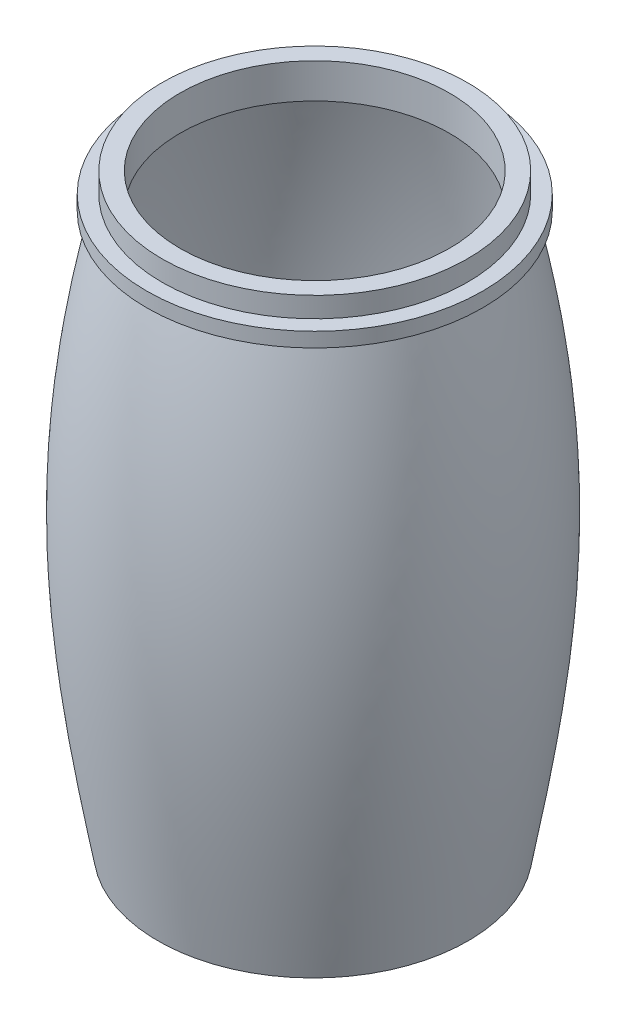
from build123d import *

# Parameters (mm, degrees)
SHELL5_T                    = -5
REVOLVE_THIN1_START         = 984.270895849
REVOLVE_THIN1_OUTLINE_R     = 260.625833246
REVOLVE_THIN1_OUTLINE_R_2   = 248.662190358
REVOLVE_THIN1_OUTLINE_R_3   = 238.662190358
REVOLVE_THIN1_DEPTH         = 61.729775532
REVOLVE_THIN1_2_OUTLINE_R   = 297.647770332
REVOLVE_THIN1_2_OUTLINE_R_2 = 287.647770332
REVOLVE_THIN1_2_OUTLINE_R_3 = 260.625833246
REVOLVE_THIN1_2_OUTLINE_R_4 = 248.662190358
REVOLVE_THIN1_2_DEPTH       = 25.729104151
REVOLVE_THIN1_3_OUTLINE_R   = 287.647770332
REVOLVE_THIN1_3_DEPTH       = 10
REVOLVE_THIN1_START_2       = 1000
REVOLVE_THIN1_4_OUTLINE_R   = 287.647770332
REVOLVE_THIN1_4_DEPTH       = 10
REVOLVE_THIN1_START_3       = 1036.000671381
REVOLVE_THIN1_5_OUTLINE_R   = 260.625833246
REVOLVE_THIN1_5_OUTLINE_R_2 = 248.662190358
REVOLVE_THIN1_5_DEPTH       = 10


# Read off the part's stored shape, not the designer's step: Revolve-Thin1
with BuildPart() as part:
    # Sketch1 → Revolve1 (revolve)
    with BuildSketch(Plane.XY):
        with BuildLine():
            Line((0, 0), (275, 0))
            add(Edge.make_bspline(
                [(275, 0), (334.204802315, 324.77989034), (372.23427441, 596.018832728), (272.550609758, 1000)],
                knots=[0, 0, 0, 0, 1, 1, 1, 1], degree=3))
            Line((272.550609758, 1000), (0, 1000))
            Line((0, 1000), (0, 0))
        make_face()
    revolve(axis=Axis((0, 0, 0), (0, 1, 0)))

    # Shell5
    shell5_openings = [part.faces().sort_by_distance(p)[0] for p in [
        (0, 1000, 0),
    ]]
    offset(amount=SHELL5_T, openings=shell5_openings, kind=Kind.INTERSECTION)

    # Revolve-Thin1 outline → Revolve-Thin1 (add)
    # profile 1 of 2: a face of its own
    with BuildSketch(Plane(origin=(0, 0, 0), x_dir=(1, 0, 0), z_dir=(0, 1, 0)).offset(REVOLVE_THIN1_START)):
        with BuildLine():
            ThreePointArc((-161.763347416, -214.689033182), (273.625833246, 0), (-161.763347416, 214.689033182))
            ThreePointArc((-161.763347416, 214.689033182), (-267.625833246, 0), (-161.763347416, -214.689033182))
        make_face()
        with Locations((3, 0)):
            Circle(REVOLVE_THIN1_OUTLINE_R, mode=Mode.SUBTRACT)
    # profile 2 of 2: a face of its own
    with BuildSketch(Plane(origin=(0, 0, 0), x_dir=(1, 0, 0), z_dir=(0, 1, 0)).offset(REVOLVE_THIN1_START)):
        with Locations((3, 0)):
            Circle(REVOLVE_THIN1_OUTLINE_R_2)
        with Locations((3, 0)):
            Circle(REVOLVE_THIN1_OUTLINE_R_3, mode=Mode.SUBTRACT)
    extrude(amount=REVOLVE_THIN1_DEPTH)

    # Revolve-Thin1 2 outline → Revolve-Thin1 2 (add)
    # profile 1 of 2: a face of its own
    with BuildSketch(Plane(origin=(0, 0, 0), x_dir=(1, 0, 0), z_dir=(0, 1, 0)).offset(REVOLVE_THIN1_START)):
        with Locations((3, 0)):
            Circle(REVOLVE_THIN1_2_OUTLINE_R)
        with Locations((3, 0)):
            Circle(REVOLVE_THIN1_2_OUTLINE_R_2, mode=Mode.SUBTRACT)
    # profile 2 of 2: a face of its own
    with BuildSketch(Plane(origin=(0, 0, 0), x_dir=(1, 0, 0), z_dir=(0, 1, 0)).offset(REVOLVE_THIN1_START)):
        with Locations((3, 0)):
            Circle(REVOLVE_THIN1_2_OUTLINE_R_3)
        with Locations((3, 0)):
            Circle(REVOLVE_THIN1_2_OUTLINE_R_4, mode=Mode.SUBTRACT)
    extrude(amount=REVOLVE_THIN1_2_DEPTH)

    # Revolve-Thin1 3 outline → Revolve-Thin1 3 (add)
    with BuildSketch(Plane(origin=(0, 0, 0), x_dir=(1, 0, 0), z_dir=(0, 1, 0)).offset(REVOLVE_THIN1_START)):
        with Locations((3, 0)):
            Circle(REVOLVE_THIN1_3_OUTLINE_R)
        with BuildLine():
            ThreePointArc((-161.763347415, -214.689033181), (-267.625833246, 0), (-161.763347415, 214.689033181))
            ThreePointArc((-161.763347415, 214.689033181), (273.625833246, 0), (-161.763347415, -214.689033181))
        make_face(mode=Mode.SUBTRACT)
    extrude(amount=REVOLVE_THIN1_3_DEPTH)

    # Revolve-Thin1 4 outline → Revolve-Thin1 4 (add)
    with BuildSketch(Plane(origin=(0, 0, 0), x_dir=(1, 0, 0), z_dir=(0, 1, 0)).offset(REVOLVE_THIN1_START_2)):
        with Locations((3, 0)):
            Circle(REVOLVE_THIN1_4_OUTLINE_R)
        with BuildLine():
            ThreePointArc((-161.763347415, -214.689033181), (-267.625833246, 0), (-161.763347415, 214.689033181))
            ThreePointArc((-161.763347415, 214.689033181), (273.625833246, 0), (-161.763347415, -214.689033181))
        make_face(mode=Mode.SUBTRACT)
    extrude(amount=REVOLVE_THIN1_4_DEPTH)

    # Revolve-Thin1 5 outline → Revolve-Thin1 5 (add)
    with BuildSketch(Plane(origin=(0, 0, 0), x_dir=(1, 0, 0), z_dir=(0, 1, 0)).offset(REVOLVE_THIN1_START_3)):
        with Locations((3, 0)):
            Circle(REVOLVE_THIN1_5_OUTLINE_R)
        with Locations((3, 0)):
            Circle(REVOLVE_THIN1_5_OUTLINE_R_2, mode=Mode.SUBTRACT)
    extrude(amount=REVOLVE_THIN1_5_DEPTH)


solid = part.part
